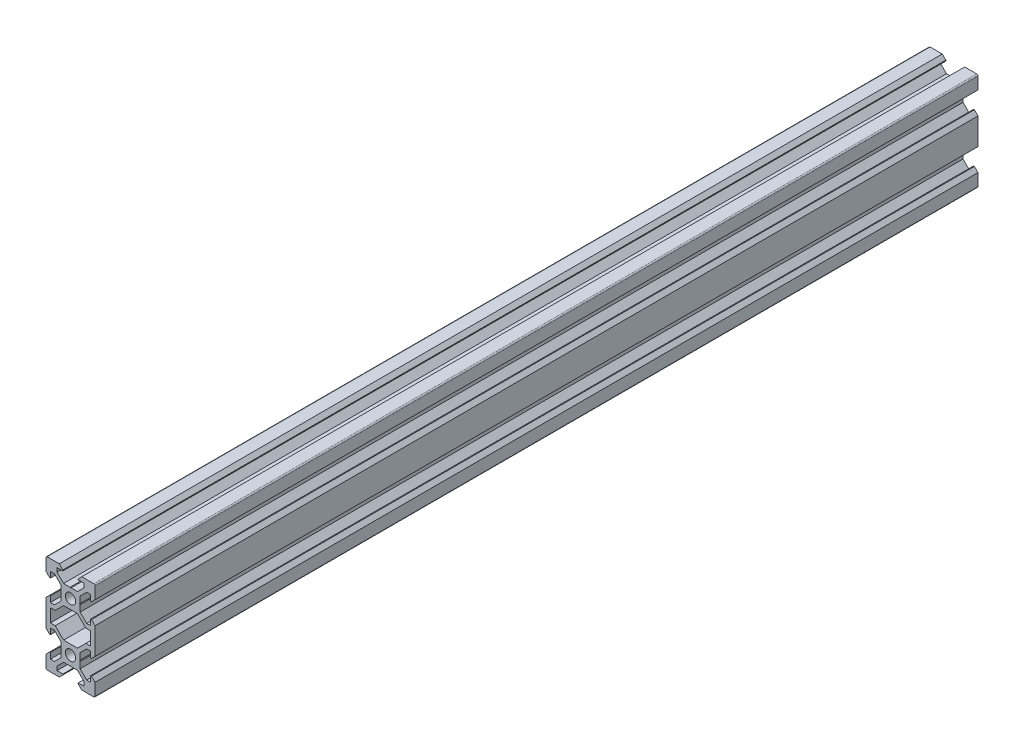
from build123d import *

# Parameters (mm, degrees)
SKETCH1_R           = 2.1
BOSS_EXTRUDE1_DEPTH = 360


with BuildPart() as part:
    # Sketch1 → Boss-Extrude1 (new body)
    with BuildSketch(Plane.XY):
        with BuildLine():
            Line((4.58, -20), (9.5, -20))
            ThreePointArc((9.5, -20), (9.853553391, -19.853553391), (10, -19.5))
            Line((10, -19.5), (10, -14.58))
            Line((10, -14.58), (8.545, -13.125))
            Line((8.545, -13.125), (8.2, -13.125))
            Line((8.2, -13.125), (8.2, -15.5))
            Line((8.2, -15.5), (6.560660172, -15.5))
            Line((6.560660172, -15.5), (3.9, -12.839339828))
            Line((3.9, -12.839339828), (3.9, -10.21))
            Line((3.9, -10.21), (3.69, -10))
            Line((3.69, -10), (3.9, -9.79))
            Line((3.9, -9.79), (3.9, -7.160660172))
            Line((3.9, -7.160660172), (6.560660172, -4.5))
            Line((6.560660172, -4.5), (8.2, -4.5))
            Line((8.2, -4.5), (8.2, -6.875))
            Line((8.2, -6.875), (8.545, -6.875))
            Line((8.545, -6.875), (10, -5.42))
            Line((10, -5.42), (10, 5.42))
            Line((10, 5.42), (8.545, 6.875))
            Line((8.545, 6.875), (8.2, 6.875))
            Line((8.2, 6.875), (8.2, 4.5))
            Line((8.2, 4.5), (6.560660172, 4.5))
            Line((6.560660172, 4.5), (3.9, 7.160660172))
            Line((3.9, 7.160660172), (3.9, 9.79))
            Line((3.9, 9.79), (3.69, 10))
            Line((3.69, 10), (3.9, 10.21))
            Line((3.9, 10.21), (3.9, 12.839339828))
            Line((3.9, 12.839339828), (6.560660172, 15.5))
            Line((6.560660172, 15.5), (8.2, 15.5))
            Line((8.2, 15.5), (8.2, 13.125))
            Line((8.2, 13.125), (8.545, 13.125))
            Line((8.545, 13.125), (10, 14.58))
            Line((10, 14.58), (10, 19.5))
            ThreePointArc((10, 19.5), (9.853553391, 19.853553391), (9.5, 20))
            Line((9.5, 20), (4.58, 20))
            Line((4.58, 20), (3.125, 18.545))
            Line((3.125, 18.545), (3.125, 18.2))
            Line((3.125, 18.2), (5.5, 18.2))
            Line((5.5, 18.2), (5.5, 16.560660172))
            Line((5.5, 16.560660172), (2.839339828, 13.9))
            Line((2.839339828, 13.9), (0.21, 13.9))
            Line((0.21, 13.9), (0, 13.69))
            Line((0, 13.69), (-0.21, 13.9))
            Line((-0.21, 13.9), (-2.839339828, 13.9))
            Line((-2.839339828, 13.9), (-5.5, 16.560660172))
            Line((-5.5, 16.560660172), (-5.5, 18.2))
            Line((-5.5, 18.2), (-3.125, 18.2))
            Line((-3.125, 18.2), (-3.125, 18.545))
            Line((-3.125, 18.545), (-4.58, 20))
            Line((-4.58, 20), (-9.5, 20))
            ThreePointArc((-9.5, 20), (-9.853553391, 19.853553391), (-10, 19.5))
            Line((-10, 19.5), (-10, 14.58))
            Line((-10, 14.58), (-8.545, 13.125))
            Line((-8.545, 13.125), (-8.2, 13.125))
            Line((-8.2, 13.125), (-8.2, 15.5))
            Line((-8.2, 15.5), (-6.560660172, 15.5))
            Line((-6.560660172, 15.5), (-3.9, 12.839339828))
            Line((-3.9, 12.839339828), (-3.9, 10.21))
            Line((-3.9, 10.21), (-3.69, 10))
            Line((-3.69, 10), (-3.9, 9.79))
            Line((-3.9, 9.79), (-3.9, 7.160660172))
            Line((-3.9, 7.160660172), (-6.560660172, 4.5))
            Line((-6.560660172, 4.5), (-8.2, 4.5))
            Line((-8.2, 4.5), (-8.2, 6.875))
            Line((-8.2, 6.875), (-8.545, 6.875))
            Line((-8.545, 6.875), (-10, 5.42))
            Line((-10, 5.42), (-10, -5.42))
            Line((-10, -5.42), (-8.545, -6.875))
            Line((-8.545, -6.875), (-8.2, -6.875))
            Line((-8.2, -6.875), (-8.2, -4.5))
            Line((-8.2, -4.5), (-6.560660172, -4.5))
            Line((-6.560660172, -4.5), (-3.9, -7.160660172))
            Line((-3.9, -7.160660172), (-3.9, -9.79))
            Line((-3.9, -9.79), (-3.69, -10))
            Line((-3.69, -10), (-3.9, -10.21))
            Line((-3.9, -10.21), (-3.9, -12.839339828))
            Line((-3.9, -12.839339828), (-6.560660172, -15.5))
            Line((-6.560660172, -15.5), (-8.2, -15.5))
            Line((-8.2, -15.5), (-8.2, -13.125))
            Line((-8.2, -13.125), (-8.545, -13.125))
            Line((-8.545, -13.125), (-10, -14.58))
            Line((-10, -14.58), (-10, -19.5))
            ThreePointArc((-10, -19.5), (-9.853553391, -19.853553391), (-9.5, -20))
            Line((-9.5, -20), (-4.58, -20))
            Line((-4.58, -20), (-3.125, -18.545))
            Line((-3.125, -18.545), (-3.125, -18.2))
            Line((-3.125, -18.2), (-5.5, -18.2))
            Line((-5.5, -18.2), (-5.5, -16.560660172))
            Line((-5.5, -16.560660172), (-2.839339828, -13.9))
            Line((-2.839339828, -13.9), (-0.21, -13.9))
            Line((-0.21, -13.9), (0, -13.69))
            Line((0, -13.69), (0.21, -13.9))
            Line((0.21, -13.9), (2.839339828, -13.9))
            Line((2.839339828, -13.9), (5.5, -16.560660172))
            Line((5.5, -16.560660172), (5.5, -18.2))
            Line((5.5, -18.2), (3.125, -18.2))
            Line((3.125, -18.2), (3.125, -18.545))
            Line((3.125, -18.545), (4.58, -20))
        make_face()
        with Locations((0, -10)):
            Circle(SKETCH1_R, mode=Mode.SUBTRACT)
        Polygon((-6.239339828, -2.7), (-8.2, -2.7), (-8.2, 2.7), (-6.239339828, 2.7), (-2.839339828, 6.1), (2.839339828, 6.1), (6.239339828, 2.7), (8.2, 2.7), (8.2, -2.7), (6.239339828, -2.7), (2.839339828, -6.1), (-2.839339828, -6.1), align=None, mode=Mode.SUBTRACT)
        with Locations((0, 10)):
            Circle(SKETCH1_R, mode=Mode.SUBTRACT)
    extrude(amount=BOSS_EXTRUDE1_DEPTH)


solid = part.part
